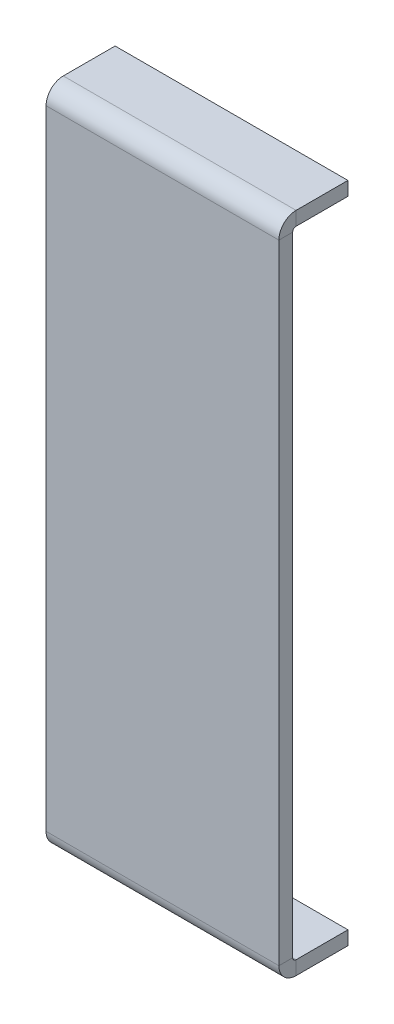
from build123d import *

# Parameters (mm, degrees)
SKETCH1_W                    = 50.580870405
SKETCH1_H                    = 144
BASE_FLANGE1_DEPTH           = 3
EDGE_FLANGE1_STRIP_W         = 13.4732
EDGE_FLANGE1_STRIP_H         = 3
EDGE_FLANGE1_STRIP_CUT_DEPTH = 50.580870405
EDGE_FLANGE1_DEPTH           = 50.580870405
EDGE_FLANGE2_STRIP_W         = 13.4732
EDGE_FLANGE2_STRIP_H         = 3
EDGE_FLANGE2_STRIP_CUT_DEPTH = 50.580870405
EDGE_FLANGE2_DEPTH           = 50.580870405


# Sheet-metal steps are written as plain solids
with BuildPart() as part:
    # Sketch1 → Base-Flange1 (new body)
    with BuildSketch(Plane.XY):
        with Locations((46.586592155, 25.88784612)):
            Rectangle(SKETCH1_W, SKETCH1_H)
    extrude(amount=-BASE_FLANGE1_DEPTH)

    # Edge-Flange1 strip (across the edge) → Edge-Flange1 strip cut (cut)
    with BuildSketch(Plane(origin=(71.877027357, -46.11215388, -3), x_dir=(0, 1, 0), z_dir=(-1, 0, 0))):
        with Locations((-3, -1.5)):
            Rectangle(EDGE_FLANGE1_STRIP_W, EDGE_FLANGE1_STRIP_H)
    extrude(amount=EDGE_FLANGE1_STRIP_CUT_DEPTH, mode=Mode.SUBTRACT)

    # Edge-Flange1 section (across the edge) → Edge-Flange1 (add)
    with BuildSketch(Plane(origin=(71.877027357, -46.11215388, -3), x_dir=(0, 1, 0), z_dir=(-1, 0, 0))):
        with BuildLine():
            Line((0, 0.7366), (0, 12))
            Line((0, 12), (3, 12))
            Line((3, 12), (3, 0.7366))
            ThreePointArc((3, 0.7366), (3.215745145, 0.215745145), (3.7366, 0))
            Line((3.7366, 0), (3.7366, -3))
            ThreePointArc((3.7366, -3), (1.094424801, -1.905575199), (0, 0.7366))
        make_face()
    extrude(amount=EDGE_FLANGE1_DEPTH)

    # Edge-Flange2 strip (across the edge) → Edge-Flange2 strip cut (cut)
    with BuildSketch(Plane(origin=(21.296156952, 97.88784612, -3), x_dir=(0, -1, 0), z_dir=(1, 0, 0))):
        with Locations((-3, -1.5)):
            Rectangle(EDGE_FLANGE2_STRIP_W, EDGE_FLANGE2_STRIP_H)
    extrude(amount=EDGE_FLANGE2_STRIP_CUT_DEPTH, mode=Mode.SUBTRACT)

    # Edge-Flange2 section (across the edge) → Edge-Flange2 (add)
    with BuildSketch(Plane(origin=(21.296156952, 97.88784612, -3), x_dir=(0, -1, 0), z_dir=(1, 0, 0))):
        with BuildLine():
            Line((0, 0.7366), (0, 12))
            Line((0, 12), (3, 12))
            Line((3, 12), (3, 0.7366))
            ThreePointArc((3, 0.7366), (3.215745145, 0.215745145), (3.7366, 0))
            Line((3.7366, 0), (3.7366, -3))
            ThreePointArc((3.7366, -3), (1.094424801, -1.905575199), (0, 0.7366))
        make_face()
    extrude(amount=EDGE_FLANGE2_DEPTH)


solid = part.part
